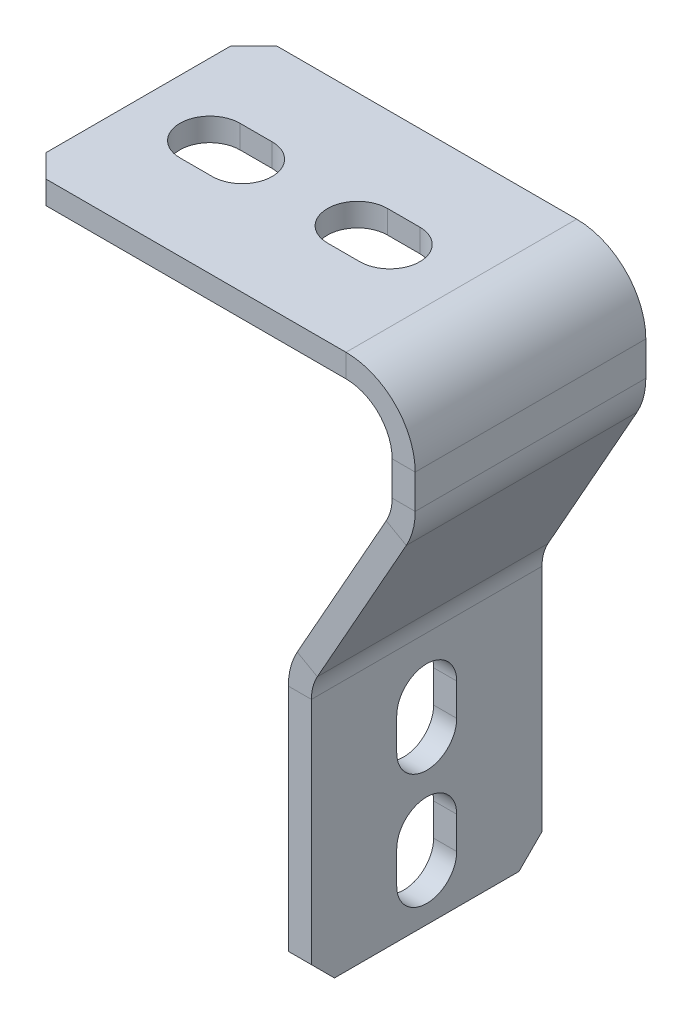
from build123d import *

# Parameters (mm, degrees)
SM_BASE_FLANGE_1_DEPTH = 50
OTHER_START            = -40.658639918
OTHER_1_OUTLINE_W      = 38
OTHER_1_OUTLINE_H      = 8
OTHER_1_DEPTH          = 3.535533906
OTHER_START_2          = -76.013978978
OTHER_1_2_OUTLINE_W    = 10
OTHER_1_2_OUTLINE_H    = 8
OTHER_1_2_DEPTH        = 3.535533906
OTHER_1_3_OUTLINE_W    = 7
OTHER_1_3_OUTLINE_H    = 10
OTHER_1_3_DEPTH        = 3.535533906
OTHER_START_3          = -35.355339059
OTHER_1_4_OUTLINE_W    = 7
OTHER_1_4_OUTLINE_H    = 38
OTHER_1_4_DEPTH        = 3.535533906
CUT_EXTRUDE_3_DEPTH    = 10
CUT_EXTRUDE_4_DEPTH    = 10


# Read off the part's stored shape, not the designer's step: Затупленный угол1
# Sheet-metal steps are written as plain solids
with BuildPart() as part:
    # Sketch 1 → Базовая кромка1 (new body)
    with BuildSketch(Plane.XY):
        with BuildLine():
            Line((0, 0), (0, 54.804758849))
            ThreePointArc((0, 54.804758849), (0.489581401, 58.605778722), (1.926366943, 62.158677443))
            Line((1.926366943, 62.158677443), (21.215755371, 96.450923538))
            ThreePointArc((21.215755371, 96.450923538), (22.1736124, 98.819522686), (22.5, 101.353535934))
            Line((22.5, 101.353535934), (22.5, 108.7340251))
            ThreePointArc((22.5, 108.7340251), (19.571067812, 115.805092912), (12.5, 118.7340251))
            Line((12.5, 118.7340251), (-57.5, 118.7340251))
            Line((-57.5, 118.7340251), (-57.5, 123.7340251))
            Line((-57.5, 123.7340251), (12.5, 123.7340251))
            ThreePointArc((12.5, 123.7340251), (23.106601718, 119.340626818), (27.5, 108.7340251))
            Line((27.5, 108.7340251), (27.5, 101.353535934))
            ThreePointArc((27.5, 101.353535934), (27.010418599, 97.552516061), (25.573633057, 93.99961734))
            Line((25.573633057, 93.99961734), (6.284244629, 59.707371245))
            ThreePointArc((6.284244629, 59.707371245), (5.3263876, 57.338772097), (5, 54.804758849))
            Line((5, 54.804758849), (5, 0))
            Line((5, 0), (0, 0))
        make_face()
    extrude(amount=SM_BASE_FLANGE_1_DEPTH)

    # Other 1 outline → Other 1 (cut)
    with BuildSketch(Plane(origin=(0, 0, 0), x_dir=(0.7071067811865474, 0, -0.7071067811865477), z_dir=(0.7071067811865476, 0, 0.7071067811865476)).offset(OTHER_START)):
        with Locations((-55, 121)):
            Rectangle(OTHER_1_OUTLINE_W, OTHER_1_OUTLINE_H)
    extrude(amount=OTHER_1_DEPTH, mode=Mode.SUBTRACT)

    # Other 1 2 outline → Other 1 2 (cut)
    with BuildSketch(Plane(origin=(0, 0, 0), x_dir=(0.7071067811865474, 0, 0.7071067811865477), z_dir=(0.7071067811865476, 0, -0.7071067811865476)).offset(OTHER_START_2)):
        with Locations((-5, -121)):
            Rectangle(OTHER_1_2_OUTLINE_W, OTHER_1_2_OUTLINE_H)
    extrude(amount=OTHER_1_2_DEPTH, mode=Mode.SUBTRACT)

    # Other 1 3 outline → Other 1 3 (cut)
    with BuildSketch(Plane(origin=(0, 0, 0), x_dir=(1, 0, 0), z_dir=(0, 0.7071067811865476, 0.7071067811865476))):
        with Locations((2.5, 0)):
            Rectangle(OTHER_1_3_OUTLINE_W, OTHER_1_3_OUTLINE_H)
    extrude(amount=OTHER_1_3_DEPTH, mode=Mode.SUBTRACT)

    # Other 1 4 outline → Other 1 4 (cut)
    with BuildSketch(Plane(origin=(0, 0, 0), x_dir=(1, 0, 0), z_dir=(0, 0.7071067811865476, -0.7071067811865476)).offset(OTHER_START_3)):
        with Locations((2.5, -21)):
            Rectangle(OTHER_1_4_OUTLINE_W, OTHER_1_4_OUTLINE_H)
    extrude(amount=OTHER_1_4_DEPTH, mode=Mode.SUBTRACT)

    # Эскиз4 → Вырез-Вытянуть3 (cut)
    with BuildSketch(Plane.XZ.offset(-118.7340251)):
        with BuildLine():
            Line((-35, 18.5), (-42, 18.5))
            ThreePointArc((-42, 18.5), (-48.5, 25), (-42, 31.5))
            Line((-42, 31.5), (-35, 31.5))
            ThreePointArc((-35, 31.5), (-28.5, 25), (-35, 18.5))
        make_face()
        with BuildLine():
            Line((-3, 18.5), (-10, 18.5))
            ThreePointArc((-10, 18.5), (-16.5, 25), (-10, 31.5))
            Line((-10, 31.5), (-3, 31.5))
            ThreePointArc((-3, 31.5), (3.5, 25), (-3, 18.5))
        make_face()
    extrude(amount=-CUT_EXTRUDE_3_DEPTH, mode=Mode.SUBTRACT)

    # Эскиз5 → Вырез-Вытянуть4 (cut)
    with BuildSketch(Plane.ZY):
        with BuildLine():
            Line((18.5, 10.5), (18.5, 17.5))
            ThreePointArc((18.5, 17.5), (25, 24), (31.5, 17.5))
            Line((31.5, 17.5), (31.5, 10.5))
            ThreePointArc((31.5, 10.5), (25, 4), (18.5, 10.5))
        make_face()
        with BuildLine():
            Line((18.5, 35.5), (18.5, 42.5))
            ThreePointArc((18.5, 42.5), (25, 49), (31.5, 42.5))
            Line((31.5, 42.5), (31.5, 35.5))
            ThreePointArc((31.5, 35.5), (25, 29), (18.5, 35.5))
        make_face()
    extrude(amount=-CUT_EXTRUDE_4_DEPTH, mode=Mode.SUBTRACT)


solid = part.part
